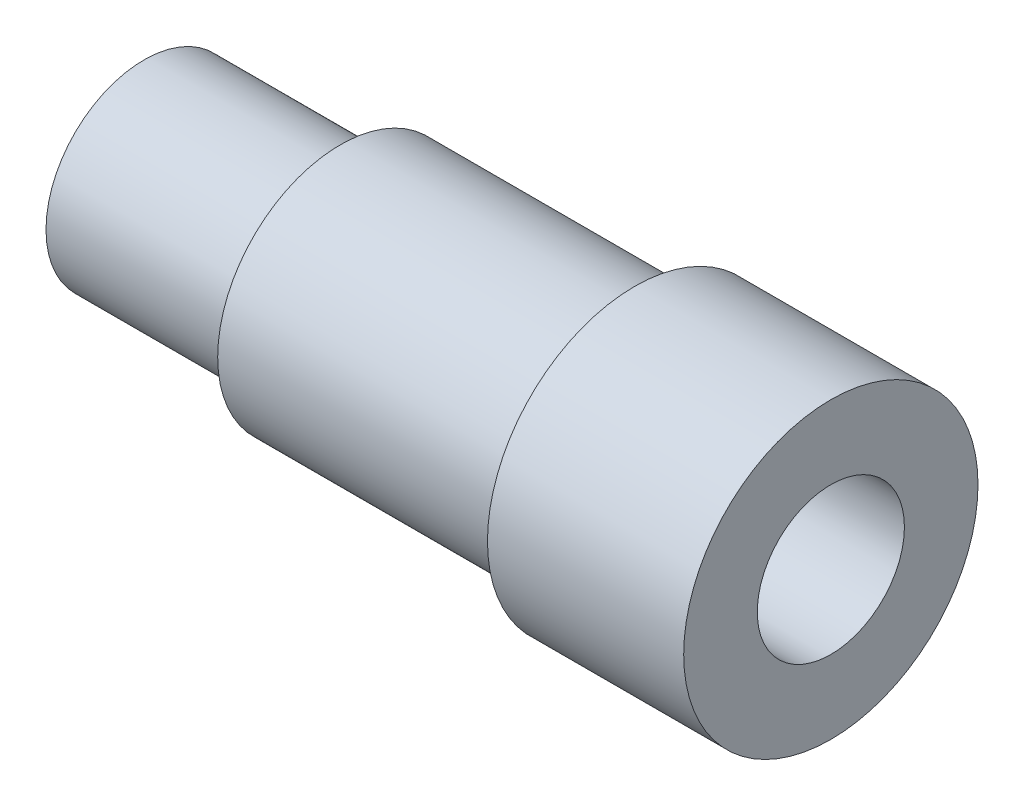
from build123d import *

# Parameters (mm, degrees)
SKETCH2_R           = 7.9375
SKETCH2_R_2         = 4.7625
BOSS_EXTRUDE1_DEPTH = 44.45
BOSS_EXTRUDE2_START = -12.7
SKETCH3_R           = 9.525
SKETCH3_R_2         = 7.9375
BOSS_EXTRUDE2_DEPTH = 12.7
SKETCH4_R           = 7.9375
SKETCH4_R_2         = 6.35
CUT_EXTRUDE1_DEPTH  = 12.7


with BuildPart() as part:
    # Sketch2 → Boss-Extrude1 (new body)
    with BuildSketch(Plane.YZ):
        Circle(SKETCH2_R)
        Circle(SKETCH2_R_2, mode=Mode.SUBTRACT)
    extrude(amount=BOSS_EXTRUDE1_DEPTH)

    # Sketch3 → Boss-Extrude2 (add)
    with BuildSketch(Plane.YZ.offset(44.45).offset(BOSS_EXTRUDE2_START)):
        Circle(SKETCH3_R)
        Circle(SKETCH3_R_2, mode=Mode.SUBTRACT)
    extrude(amount=BOSS_EXTRUDE2_DEPTH)

    # Sketch4 → Cut-Extrude1 (cut)
    with BuildSketch(Plane(origin=(0, 0, 0), x_dir=(0, -1, 0), z_dir=(-1, 0, 0))):
        Circle(SKETCH4_R)
        Circle(SKETCH4_R_2, mode=Mode.SUBTRACT)
    extrude(amount=-CUT_EXTRUDE1_DEPTH, mode=Mode.SUBTRACT)


solid = part.part
